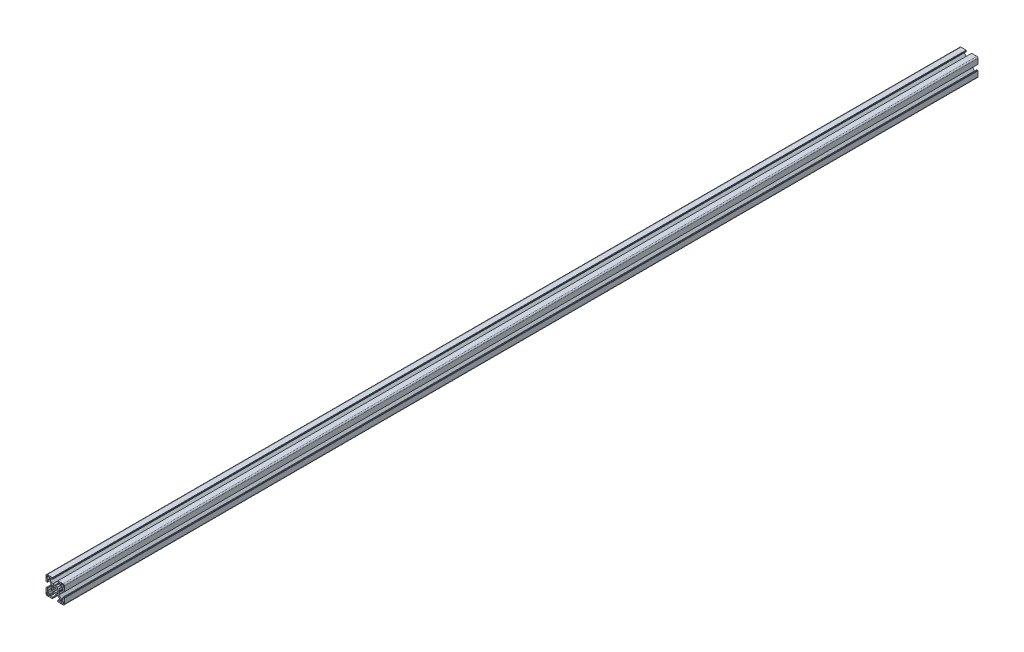
from build123d import *

# Parameters (mm, degrees)
BOSS_EXTRUDE1_DEPTH = 750
CIRPATTERN1_COUNT   = 4


with BuildPart() as part:
    # Sketch3 → Boss-Extrude1 (new, symmetric)
    with BuildSketch(Plane.XY):
        with BuildLine():
            Line((-4.503841895, 3.156803476), (-3.14772708, 1.530298739))
            ThreePointArc((-3.14772708, 1.530298739), (-3.410794979, 0.785160882), (-3.5, 0))
            Line((-3.5, 0), (-5.5, 0))
            Line((-5.5, 0), (-6, 0.866025404))
            Line((-6, 0.866025404), (-6, 3.996841995))
            ThreePointArc((-6, 3.996841995), (-6.038060234, 4.188183711), (-6.146446609, 4.350395385))
            Line((-6.146446609, 4.350395385), (-9.917104615, 8.121053391))
            ThreePointArc((-9.917104615, 8.121053391), (-10.079316289, 8.229439766), (-10.270658005, 8.2675))
            Line((-10.270658005, 8.2675), (-12.29, 8.2675))
            ThreePointArc((-12.29, 8.2675), (-12.643553391, 8.121053391), (-12.79, 7.7675))
            Line((-12.79, 7.7675), (-12.79, 4.5))
            ThreePointArc((-12.79, 4.5), (-12.936446609, 4.146446609), (-13.29, 4))
            Line((-13.29, 4), (-14.5, 4))
            Line((-14.5, 4), (-14.5, 4.5))
            Line((-14.5, 4.5), (-15, 4.5))
            Line((-15, 4.5), (-15, 12.968))
            ThreePointArc((-15, 12.968), (-14.404840979, 14.404840979), (-12.968, 15))
            Line((-12.968, 15), (-4.5, 15))
            Line((-4.5, 15), (-4.5, 14.5))
            Line((-4.5, 14.5), (-4, 14.5))
            Line((-4, 14.5), (-4, 13.29))
            ThreePointArc((-4, 13.29), (-4.146446609, 12.936446609), (-4.5, 12.79))
            Line((-4.5, 12.79), (-7.7675, 12.79))
            ThreePointArc((-7.7675, 12.79), (-8.121053391, 12.643553391), (-8.2675, 12.29))
            Line((-8.2675, 12.29), (-8.2675, 10.270658005))
            ThreePointArc((-8.2675, 10.270658005), (-8.229439766, 10.079316289), (-8.121053391, 9.917104615))
            Line((-8.121053391, 9.917104615), (-4.350395385, 6.146446609))
            ThreePointArc((-4.350395385, 6.146446609), (-4.188183711, 6.038060234), (-3.996841995, 6))
            Line((-3.996841995, 6), (-0.866025404, 6))
            Line((-0.866025404, 6), (0, 5.5))
            Line((0, 5.5), (0, 3.5))
            ThreePointArc((0, 3.5), (-0.785160882, 3.410794979), (-1.530298739, 3.14772708))
            Line((-1.530298739, 3.14772708), (-3.156803476, 4.503841895))
            ThreePointArc((-3.156803476, 4.503841895), (-3.889087297, 3.889087297), (-4.503841895, 3.156803476))
        make_face()
        with BuildLine():
            Line((-12.705, 9.5135), (-10.5135, 9.5135))
            ThreePointArc((-10.5135, 9.5135), (-9.806393219, 9.806393219), (-9.5135, 10.5135))
            Line((-9.5135, 10.5135), (-9.5135, 12.705))
            ThreePointArc((-9.5135, 12.705), (-9.806393219, 13.412106781), (-10.5135, 13.705))
            Line((-10.5135, 13.705), (-12.705, 13.705))
            ThreePointArc((-12.705, 13.705), (-13.412106781, 13.412106781), (-13.705, 12.705))
            Line((-13.705, 12.705), (-13.705, 10.5135))
            ThreePointArc((-13.705, 10.5135), (-13.412106781, 9.806393219), (-12.705, 9.5135))
        make_face(mode=Mode.SUBTRACT)
    boss_extrude1 = extrude(amount=BOSS_EXTRUDE1_DEPTH, both=True)

    # CirPattern1: Boss-Extrude1 ×4 about axis
    cirpattern1_axis = Axis((0, 0, 76.2), (0, 0, -1))
    for i in range(1, CIRPATTERN1_COUNT):
        add(boss_extrude1.rotate(cirpattern1_axis, i * 360 / CIRPATTERN1_COUNT))


solid = part.part
